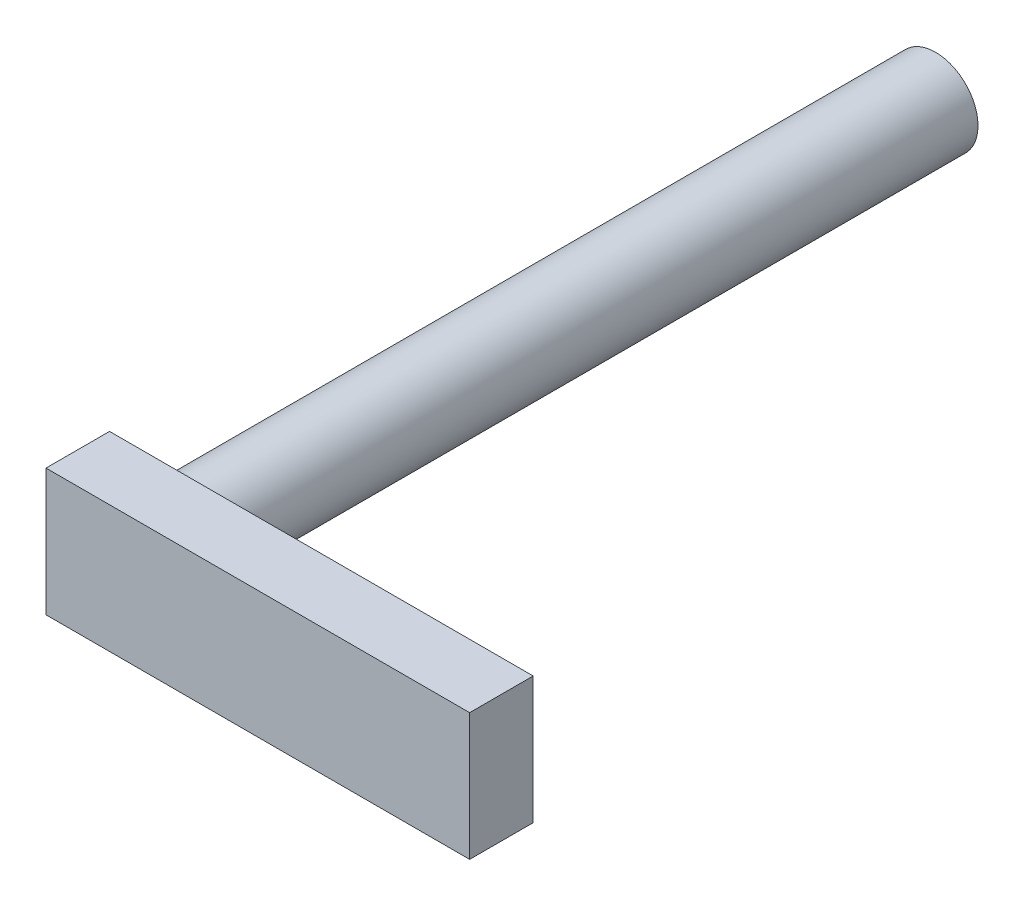
from build123d import *

# Parameters (mm, degrees)
SKETCH1_W           = 15
SKETCH1_H           = 30
BOSS_EXTRUDE1_DEPTH = 100
SKETCH2_R           = 10
BOSS_EXTRUDE2_DEPTH = 180
FILLET1_R           = 2


with BuildPart() as part:
    # Sketch1 → Boss-Extrude1 (new body)
    with BuildSketch(Plane(origin=(0, 0, 0), x_dir=(0, 0, -1), z_dir=(1, 0, 0))):
        with Locations((7.5, 15)):
            Rectangle(SKETCH1_W, SKETCH1_H)
    extrude(amount=-BOSS_EXTRUDE1_DEPTH)

    # Sketch2 → Boss-Extrude2 (add)
    with BuildSketch(Plane(origin=(0, 0, -15), x_dir=(-1, 0, 0), z_dir=(0, 0, -1))):
        with Locations((85, 15)):
            Circle(SKETCH2_R)
    extrude(amount=BOSS_EXTRUDE2_DEPTH)

    # Fillet1
    fillet1_edges = [part.edges().sort_by_distance(p)[0] for p in [
        (-75, 15, -15),
    ]]
    fillet(fillet1_edges, radius=FILLET1_R)


solid = part.part
